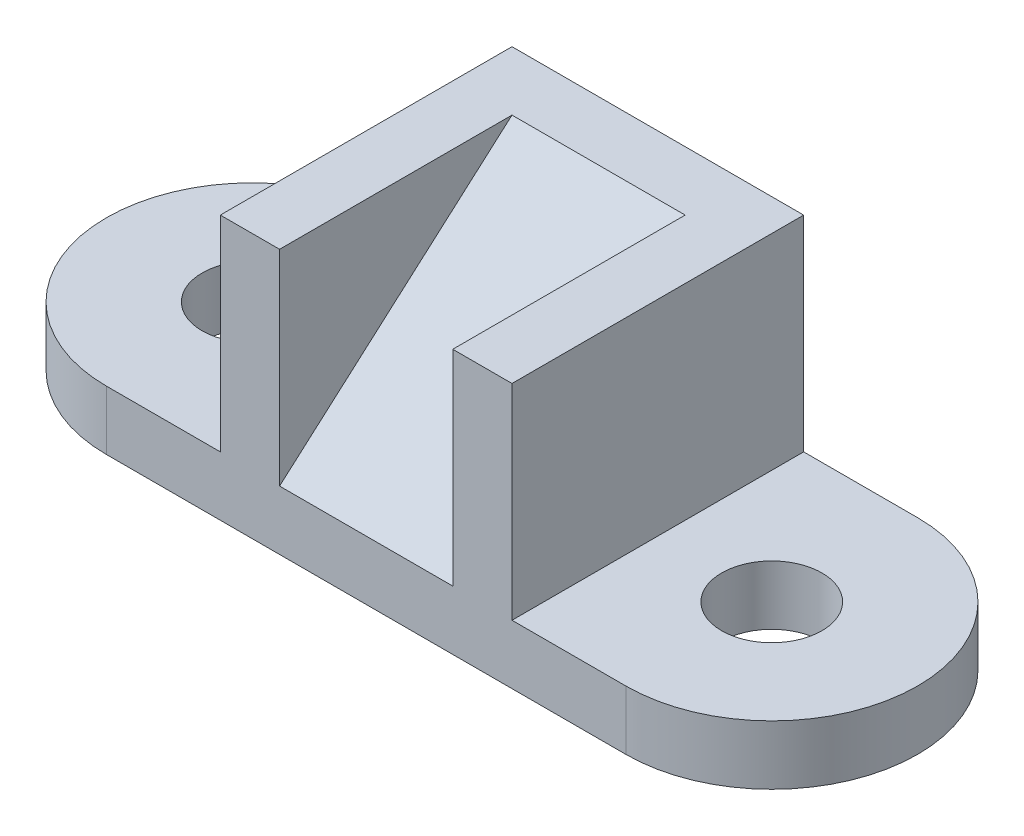
from build123d import *

# Parameters (mm, degrees)
BOSS_EXTRUDE1_DEPTH = 13
SKETCH2_R           = 11
CUT_EXTRUDE1_DEPTH  = 111.390216958
SKETCH3_W           = 32
SKETCH3_H           = 64
BOSS_EXTRUDE2_DEPTH = 45
CUT_EXTRUDE2_DEPTH  = 19


with BuildPart() as part:
    # Sketch1 → Boss-Extrude1 (new body)
    with BuildSketch(Plane(origin=(0, 0, 0), x_dir=(1, 0, 0), z_dir=(0, 1, 0))):
        with BuildLine():
            Line((-57, 0), (0, 0))
            Line((0, 0), (0, 64))
            Line((0, 64), (-57, 64))
            ThreePointArc((-57, 64), (-89, 32), (-57, 0))
        make_face()
    boss_extrude1 = extrude(amount=BOSS_EXTRUDE1_DEPTH)

    # Sketch2 → Cut-Extrude1 (cut, through all)
    with BuildSketch(Plane(origin=(0, 13, 0), x_dir=(1, 0, 0), z_dir=(0, 1, 0))):
        with Locations((-57, 32)):
            Circle(SKETCH2_R)
    cut_extrude1 = extrude(amount=-CUT_EXTRUDE1_DEPTH, mode=Mode.SUBTRACT)

    # Sketch3 → Boss-Extrude2 (add)
    with BuildSketch(Plane(origin=(0, 13, 0), x_dir=(1, 0, 0), z_dir=(0, 1, 0))):
        with Locations((-16, 32)):
            Rectangle(SKETCH3_W, SKETCH3_H)
    boss_extrude2 = extrude(amount=BOSS_EXTRUDE2_DEPTH)

    # Sketch4 → Cut-Extrude2 (cut)
    with BuildSketch(Plane(origin=(0, 0, 0), x_dir=(0, 0, -1), z_dir=(1, 0, 0))):
        Polygon((0, 13), (51, 58), (0, 58), align=None)
    cut_extrude2 = extrude(amount=-CUT_EXTRUDE2_DEPTH, mode=Mode.SUBTRACT)

    # Mirror1: Boss-Extrude1, Cut-Extrude1, Boss-Extrude2, Cut-Extrude2 across plane
    add(boss_extrude1.mirror(Plane(origin=(0, 0, 0), x_dir=(0, 0, 1), z_dir=(1, 0, 0))))
    add(cut_extrude1.mirror(Plane(origin=(0, 0, 0), x_dir=(0, 0, 1), z_dir=(1, 0, 0))), mode=Mode.SUBTRACT)
    add(boss_extrude2.mirror(Plane(origin=(0, 0, 0), x_dir=(0, 0, 1), z_dir=(1, 0, 0))))
    add(cut_extrude2.mirror(Plane(origin=(0, 0, 0), x_dir=(0, 0, 1), z_dir=(1, 0, 0))), mode=Mode.SUBTRACT)


solid = part.part
